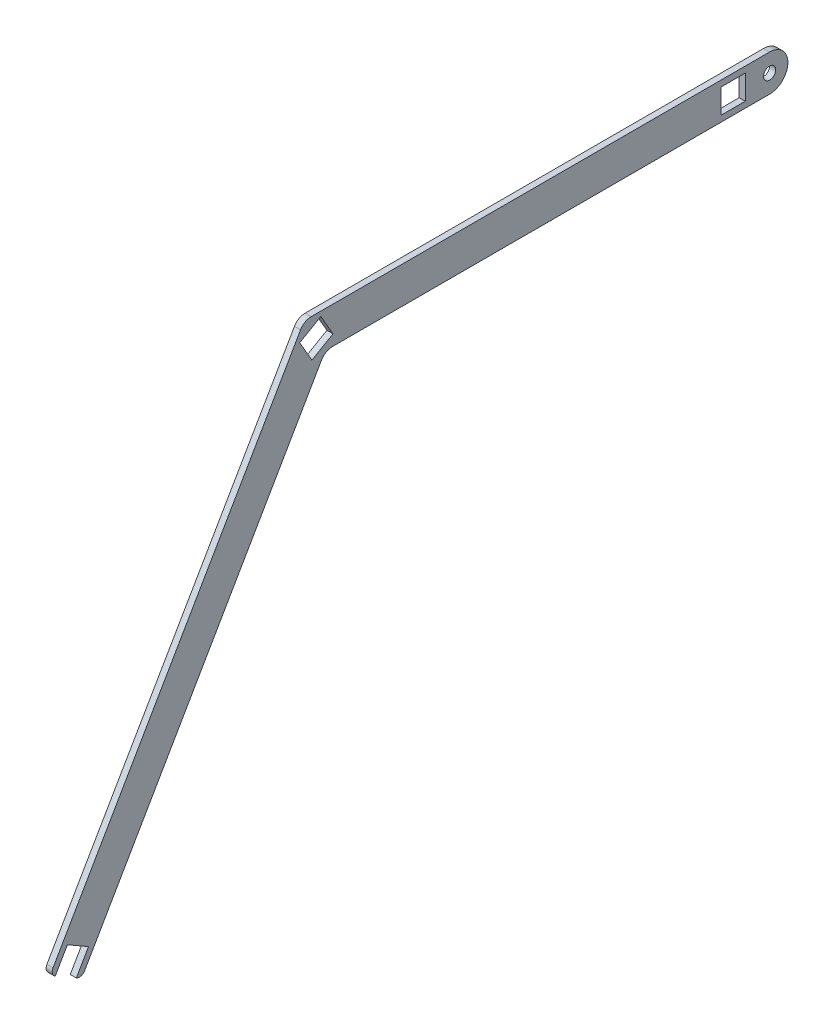
from build123d import *

# Parameters (mm, degrees)
ESQUISSE1_R        = 10
ESQUISSE1_W        = 40
ESQUISSE1_H        = 40
BOSS_EXTRU_1_DEPTH = 10
CONG_1_R           = 10
CONG_2_R           = 20


with BuildPart() as part:
    # Esquisse1 → Boss.-Extru.1 (new body)
    with BuildSketch(Plane(origin=(0, 0, 0), x_dir=(0, 0, -1), z_dir=(1, 0, 0))):
        with BuildLine():
            Line((0, 30), (-764.641016151, 30))
            Line((-764.641016151, 30), (-1181.961524227, -692.820323028))
            Line((-1181.961524227, -692.820323028), (-1173.301270189, -697.820323028))
            Line((-1173.301270189, -697.820323028), (-1153.301270189, -663.179306876))
            Line((-1153.301270189, -663.179306876), (-1118.660254038, -683.179306876))
            Line((-1118.660254038, -683.179306876), (-1138.660254038, -717.820323028))
            Line((-1138.660254038, -717.820323028), (-1130, -722.820323028))
            Line((-1130, -722.820323028), (-730, -30))
            Line((-730, -30), (0, -30))
            ThreePointArc((0, -30), (30, 0), (0, 30))
        make_face()
        Circle(ESQUISSE1_R, mode=Mode.SUBTRACT)
        with Locations((-60, 0)):
            Rectangle(ESQUISSE1_W, ESQUISSE1_H, mode=Mode.SUBTRACT)
        Polygon((-737.113248654, 22.320508076), (-771.754264805, 2.320508076), (-751.754264805, -32.320508076), (-717.113248654, -12.320508076), align=None, mode=Mode.SUBTRACT)
    extrude(amount=BOSS_EXTRU_1_DEPTH)

    # Congé1
    cong_1_edges = [part.edges().sort_by_distance(p)[0] for p in [
        (5, -692.820323028, 1181.961524227),
        (5, -722.820323028, 1130),
    ]]
    fillet(cong_1_edges, radius=CONG_1_R - 0.0001)  # a hair under: the kernel refuses the full size

    # Congé2
    cong_2_edges = [part.edges().sort_by_distance(p)[0] for p in [
        (5, -30, 730),
        (5, 30, 764.641016151),
    ]]
    fillet(cong_2_edges, radius=CONG_2_R)


solid = part.part
